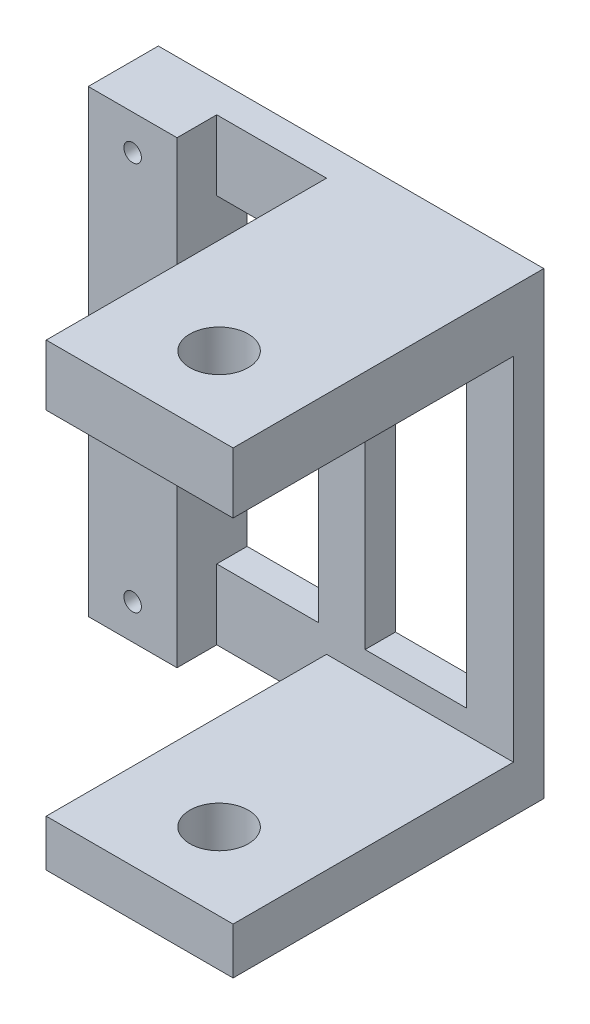
from build123d import *

# Parameters (mm, degrees)
SKETCH_2_W          = 16.5
SKETCH_2_H          = 19.65
SKETCH_2_W_2        = 4.35
SKETCH_2_H_2        = 13.65
EXTRUDE_1_DEPTH     = 1.3
SKETCH_3_W          = 8
SKETCH_3_H          = 2.6
SKETCH_3_H_2        = 2
EXTRUDE_2_DEPTH     = 12
SKETCH_10_W         = 3.8
SKETCH_10_H         = 19.65
EXTRUDE_4_DEPTH     = 1.7
CUT_EXTRUDE_2_REACH = 21.707
CUT_EXTRUDE_START   = 1.7
SKETCH_9_R          = 0.375
SKETCH_11_R         = 1.25
CUT_EXTRUDE_3_DEPTH = 26.430985038


with BuildPart() as part:
    # 草图2 → 凸台-拉伸1 (new body)
    with BuildSketch(Plane.XY):
        with Locations((-0.9, 0)):
            Rectangle(SKETCH_2_W, SKETCH_2_H)
        with Locations((-3.175, 0)):
            Rectangle(SKETCH_2_W_2, SKETCH_2_H_2, mode=Mode.SUBTRACT)
        with Locations((3.175, 0)):
            Rectangle(SKETCH_2_W_2, SKETCH_2_H_2, mode=Mode.SUBTRACT)
    extrude(amount=EXTRUDE_1_DEPTH)

    # 草图3 → 凸台-拉伸2 (add)
    with BuildSketch(Plane.XY.offset(1.3)):
        with Locations((3.35, 8.525)):
            Rectangle(SKETCH_3_W, SKETCH_3_H)
        with Locations((3.35, -8.825)):
            Rectangle(SKETCH_3_W, SKETCH_3_H_2)
    extrude(amount=EXTRUDE_2_DEPTH)

    # 草图10 → 凸台-拉伸4 (add)
    with BuildSketch(Plane.XY.offset(1.3)):
        with Locations((-7.25, 0)):
            Rectangle(SKETCH_10_W, SKETCH_10_H)
    extrude(amount=EXTRUDE_4_DEPTH)

    # 草图9 → 切除-拉伸2 (cut, up to next)
    with BuildSketch(Plane.XY.offset(1.3).offset(CUT_EXTRUDE_START), mode=Mode.PRIVATE) as cut_extrude_2_sk1:
        with Locations((-7.25, 8.325)):
            Circle(SKETCH_9_R)
    cut_extrude_2_tool1 = extrude(cut_extrude_2_sk1.sketch, amount=-CUT_EXTRUDE_2_REACH, mode=Mode.PRIVATE) & part.part
    # 草图9 → 切除-拉伸2 (cut, up to next)
    with BuildSketch(Plane.XY.offset(1.3).offset(CUT_EXTRUDE_START), mode=Mode.PRIVATE) as cut_extrude_2_sk2:
        with Locations((-7.25, -8.325)):
            Circle(SKETCH_9_R)
    cut_extrude_2_tool2 = extrude(cut_extrude_2_sk2.sketch, amount=-CUT_EXTRUDE_2_REACH, mode=Mode.PRIVATE) & part.part
    add(cut_extrude_2_tool1.solids().sort_by_distance((-7.25, 8.325, 3))[0], mode=Mode.SUBTRACT)
    add(cut_extrude_2_tool2.solids().sort_by_distance((-7.25, -8.325, 3))[0], mode=Mode.SUBTRACT)

    # 草图11 → 切除-拉伸3 (cut, through all)
    with BuildSketch(Plane.XZ.offset(9.825)):
        with Locations((3.45, 10)):
            Circle(SKETCH_11_R)
    extrude(amount=-CUT_EXTRUDE_3_DEPTH, mode=Mode.SUBTRACT)


solid = part.part
